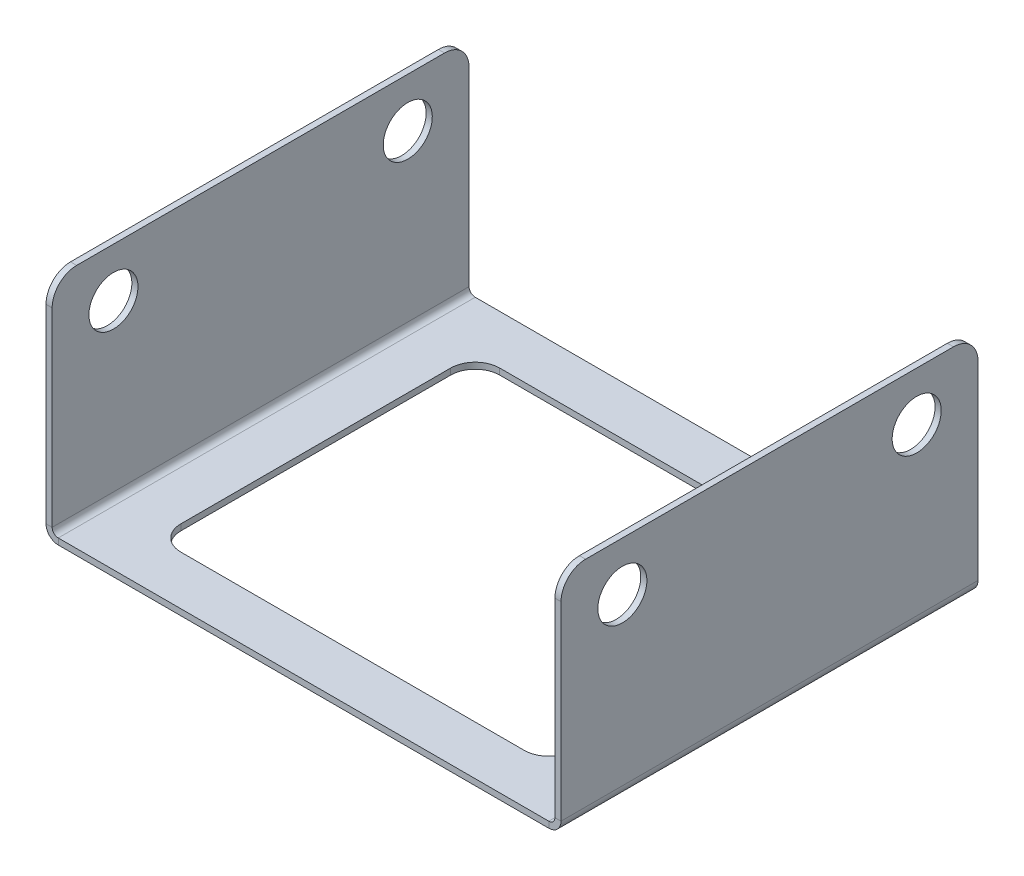
from build123d import *

# Parameters (mm, degrees)
SKETCH1_W          = 20
SKETCH1_H          = 17
BASE_FLANGE1_DEPTH = 0.25
CUT_EXTRUDE1_DEPTH = 14.126785593
EDGE_FLANGE2_DEPTH = 17
EDGE_FLANGE3_DEPTH = 17
FILLET1_R          = 1
SKETCH27_R         = 1
CUT_EXTRUDE2_DEPTH = 25.377243486


# Sheet-metal steps are written as plain solids
with BuildPart() as part:
    # Sketch1 → Base-Flange1 (new body)
    with BuildSketch(Plane(origin=(0, 0, 0), x_dir=(1, 0, 0), z_dir=(0, 1, 0))):
        Rectangle(SKETCH1_W, SKETCH1_H)
    extrude(amount=-BASE_FLANGE1_DEPTH)

    # Sketch6 → Cut-Extrude1 (cut, through all)
    with BuildSketch(Plane(origin=(0, 0, 0), x_dir=(1, 0, 0), z_dir=(0, 1, 0))):
        with BuildLine():
            Line((-7, 6.5), (7, 6.5))
            ThreePointArc((7, 6.5), (7.707106781, 6.207106781), (8, 5.5))
            Line((8, 5.5), (8, -5.5))
            ThreePointArc((8, -5.5), (7.707106781, -6.207106781), (7, -6.5))
            Line((7, -6.5), (-7, -6.5))
            ThreePointArc((-7, -6.5), (-7.707106781, -6.207106781), (-8, -5.5))
            Line((-8, -5.5), (-8, 5.5))
            ThreePointArc((-8, 5.5), (-7.707106781, 6.207106781), (-7, 6.5))
        make_face()
    extrude(amount=-CUT_EXTRUDE1_DEPTH, mode=Mode.SUBTRACT)

    # Edge-Flange2 section (across the edge) → Edge-Flange2 (add)
    with BuildSketch(Plane(origin=(10.25, 0, 8.5), x_dir=(-1, 0, 0), z_dir=(0, 0, -1))):
        with BuildLine():
            Line((-0.25, 0.25), (-0.25, 9))
            Line((-0.25, 9), (0, 9))
            Line((0, 9), (0, 0.25))
            ThreePointArc((0, 0.25), (0.073223305, 0.073223305), (0.25, 0))
            Line((0.25, 0), (0.25, -0.25))
            ThreePointArc((0.25, -0.25), (-0.103553391, -0.103553391), (-0.25, 0.25))
        make_face()
    extrude(amount=EDGE_FLANGE2_DEPTH)

    # Edge-Flange3 section (across the edge) → Edge-Flange3 (add)
    with BuildSketch(Plane(origin=(-10.25, 0, -8.5), x_dir=(1, 0, 0), z_dir=(0, 0, 1))):
        with BuildLine():
            Line((-0.25, 0.25), (-0.25, 9))
            Line((-0.25, 9), (0, 9))
            Line((0, 9), (0, 0.25))
            ThreePointArc((0, 0.25), (0.073223305, 0.073223305), (0.25, 0))
            Line((0.25, 0), (0.25, -0.25))
            ThreePointArc((0.25, -0.25), (-0.103553391, -0.103553391), (-0.25, 0.25))
        make_face()
    extrude(amount=EDGE_FLANGE3_DEPTH)

    # Fillet1
    fillet1_edges = [part.edges().sort_by_distance(p)[0] for p in [
        (10.375, 9, 8.5),
        (10.375, 9, -8.5),
        (-10.375, 9, -8.5),
        (-10.375, 9, 8.5),
    ]]
    fillet(fillet1_edges, radius=FILLET1_R)

    # Sketch27 → Cut-Extrude2 (cut, through all)
    with BuildSketch(Plane.ZY.offset(10.5)):
        with Locations(Location((-6, 7, 0), (0, 0, 270))):
            Circle(SKETCH27_R)
        with Locations(Location((6, 7, 0), (0, 0, 270))):
            Circle(SKETCH27_R)
    extrude(amount=-CUT_EXTRUDE2_DEPTH, mode=Mode.SUBTRACT)


solid = part.part
